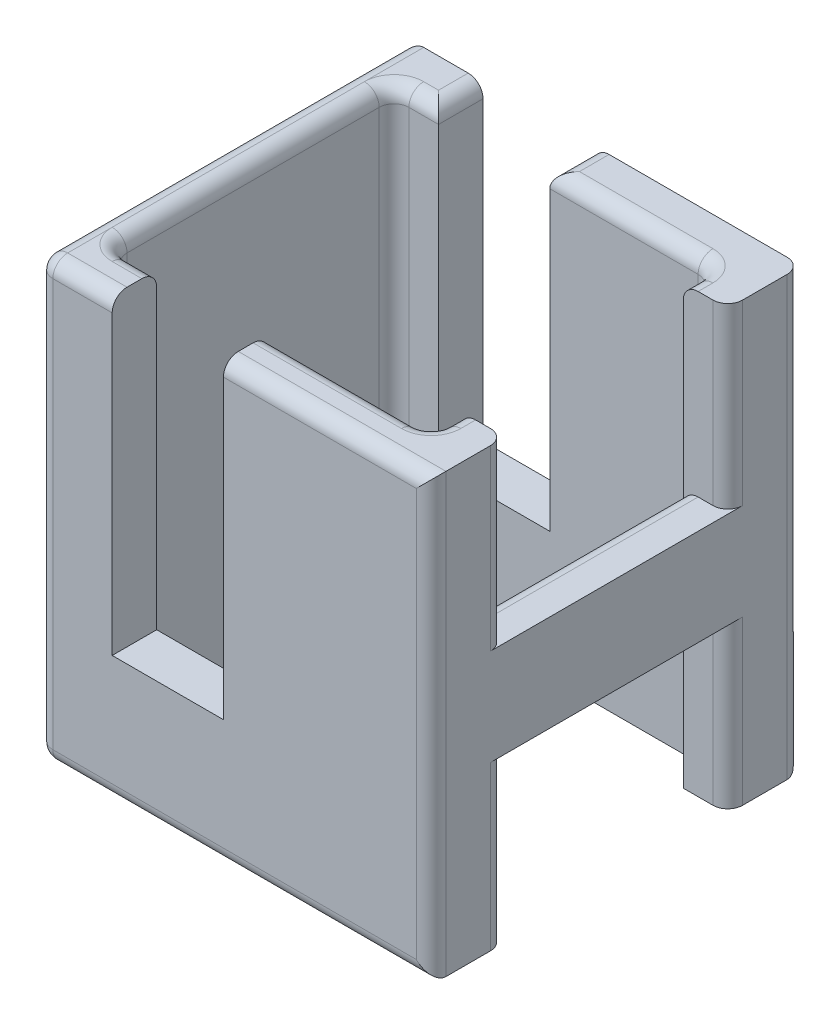
from build123d import *

# Parameters (mm, degrees)
SKETCH_1_W          = 27.5
SKETCH_1_H          = 25
SKETCH_1_W_2        = 21.5
SKETCH_1_H_2        = 19
EXTRUDE_1_DEPTH     = 36
SKETCH_3_W          = 15
SKETCH_3_H          = 30
CUT_EXTRUDE_1_DEPTH = 24.5
CUT_EXTRUDE_2_REACH = 55.397
SKETCH_4_W          = 7.5
SKETCH_4_H          = 24
SKETCH_5_W          = 25
SKETCH_5_H          = 3
SKETCH_5_H_2        = 3.5
CUT_EXTRUDE_3_DEPTH = 52.742149163
SKETCH_6_W          = 15
SKETCH_6_H          = 6.5
EXTRUDE_2_DEPTH     = 3
FILLET_1_R          = 1
SKETCH_7_W          = 1
SKETCH_7_H          = 25
CUT_EXTRUDE_5_DEPTH = 50.249365478
FILLET_3_R          = 1


with BuildPart() as part:
    # 草图1 → 凸台-拉伸1 (new body)
    with BuildSketch(Plane(origin=(0, 0, 0), x_dir=(1, 0, 0), z_dir=(0, 1, 0))):
        with Locations((16.75, 12.5)):
            Rectangle(SKETCH_1_W, SKETCH_1_H)
        with Locations((16.75, 12.5)):
            Rectangle(SKETCH_1_W_2, SKETCH_1_H_2, mode=Mode.SUBTRACT)
    extrude(amount=EXTRUDE_1_DEPTH)

    # 草图3 → 切除-拉伸1 (cut)
    with BuildSketch(Plane(origin=(30.5, 0, 0), x_dir=(0, 0, -1), z_dir=(1, 0, 0))):
        with Locations((12.5, 18)):
            Rectangle(SKETCH_3_W, SKETCH_3_H)
    extrude(amount=-CUT_EXTRUDE_1_DEPTH, mode=Mode.SUBTRACT)

    # 草图4 → 切除-拉伸2 (cut, up to next)
    with BuildSketch(Plane(origin=(0, 0, -25), x_dir=(-1, 0, 0), z_dir=(0, 0, -1)), mode=Mode.PRIVATE) as cut_extrude_2_sk1:
        with Locations((-12.75, 24)):
            Rectangle(SKETCH_4_W, SKETCH_4_H)
    cut_extrude_2_tool1 = extrude(cut_extrude_2_sk1.sketch, amount=-CUT_EXTRUDE_2_REACH, mode=Mode.PRIVATE) & part.part
    cut_extrude_2 = cut_extrude_2_tool1.solids().sort_by_distance((12.75, 24, -25))[0]
    add(cut_extrude_2, mode=Mode.SUBTRACT)

    # 草图5 → 切除-拉伸3 (cut, through all)
    with BuildSketch(Plane(origin=(30.5, 0, 0), x_dir=(0, 0, -1), z_dir=(1, 0, 0))):
        with Locations((12.5, 34.5)):
            Rectangle(SKETCH_5_W, SKETCH_5_H)
        with Locations((12.5, 1.75)):
            Rectangle(SKETCH_5_W, SKETCH_5_H_2)
    extrude(amount=-CUT_EXTRUDE_3_DEPTH, mode=Mode.SUBTRACT)

    # 草图6 → 凸台-拉伸2 (add)
    with BuildSketch(Plane(origin=(30.5, 0, 0), x_dir=(0, 0, -1), z_dir=(1, 0, 0))):
        with Locations((12.5, 17.75)):
            Rectangle(SKETCH_6_W, SKETCH_6_H)
    extrude(amount=-EXTRUDE_2_DEPTH)

    # 圆角1
    fillet_1_edges = [part.edges().sort_by_distance(p)[0] for p in [
        (30.5, 9, -5),
        (30.5, 27, -20),
        (27.5, 14.5, -12.5),
        (27.5, 21, -12.5),
        (30.5, 27, -5),
        (16.5, 33, -23.5),
        (30.5, 9, -20),
        (6, 18.25, -3),
        (27.5, 18.25, -3),
        (6, 18.25, -22),
        (27.5, 18.25, -22),
        (30.5, 18.25, 0),
        (3, 18.25, 0),
        (3, 18.25, -25),
        (30.5, 18.25, -25),
        (3, 33, -12.5),
        (9, 33, -23.5),
        (27.5, 33, -21),
        (27.5, 33, -4),
        (16.75, 33, -3),
        (6, 33, -12.5),
        (7.5, 33, -22),
        (22, 33, -22),
        (16.75, 33, 0),
        (3, 3.5, -12.5),
        (16.75, 3.5, 0),
        (16.75, 3.5, -25),
    ]]
    fillet(fillet_1_edges, radius=FILLET_1_R)

    # 草图7 → 切除-拉伸5 (cut, through all)
    with BuildSketch(Plane(origin=(0, 33, 0), x_dir=(1, 0, 0), z_dir=(0, 1, 0))):
        with Locations((3.5, 12.5)):
            Rectangle(SKETCH_7_W, SKETCH_7_H)
    extrude(amount=-CUT_EXTRUDE_5_DEPTH, mode=Mode.SUBTRACT)

    # 圆角3
    fillet_3_edges = [part.edges().sort_by_distance(p)[0] for p in [
        (4, 33, -13),
        (4, 18.75, -25),
        (4, 3.5, -12.5),
        (4, 18.25, 0),
        (4, 32.707106781, -0.292893219),
        (4, 3.792893219, -24.707106781),
        (4, 3.792893219, -0.292893219),
    ]]
    fillet(fillet_3_edges, radius=FILLET_3_R - 0.0001)  # a hair under: the kernel refuses the full size

    # 镜向1: 切除-拉伸2 across plane
    add(cut_extrude_2.mirror(Plane(origin=(0, 0, -12.5), x_dir=(1, 0, 0), z_dir=(0, 0, -1))), mode=Mode.SUBTRACT)


solid = part.part
